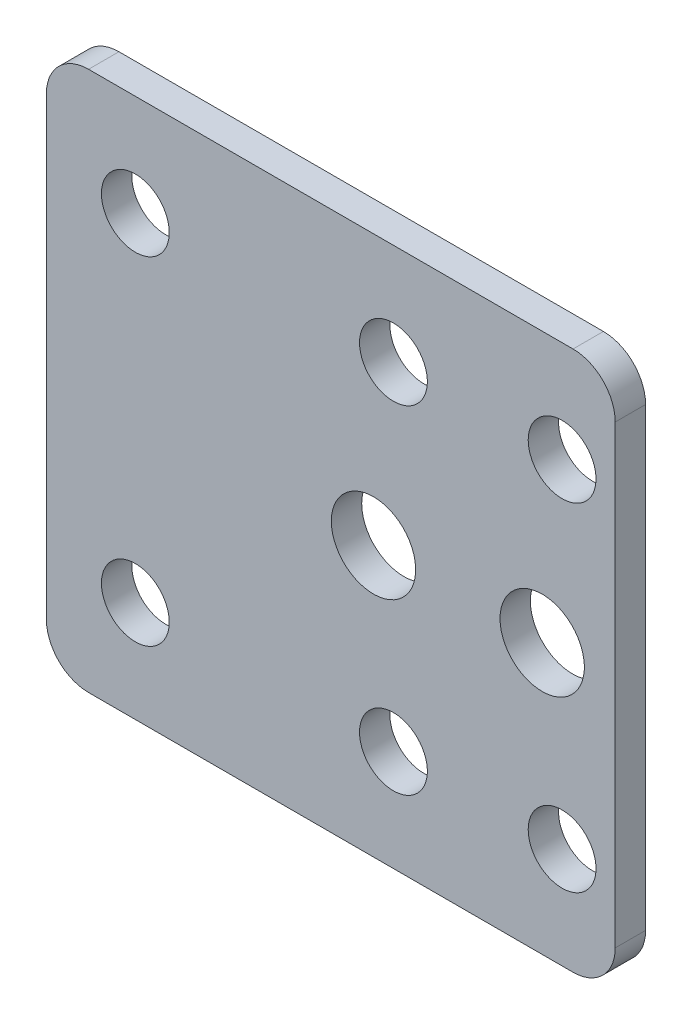
from build123d import *

# Parameters (mm, degrees)
SKETCH1_W              = 76.2
SKETCH1_H              = 40.64
BASE_FLANGE1_DEPTH     = 2.286
CUT_EXTRUDE1_REACH     = 249.845
SKETCH6_R              = 2.5527
SKETCH6_R_2            = 3.175
FILLET1_R              = 3.175
SKETCH7_W              = 53.484881044
SKETCH7_H              = 41.537228889
REMOVE_3RD_STAGE_DEPTH = 2.54
FILLET2_R              = 3.175
SKETCH8_W              = 26.577580406
SKETCH8_H              = 64.780145769
REMOVE_2ND_STAGE_DEPTH = 248.845041068
FILLET3_R              = 3.175


# Sheet-metal steps are written as plain solids
with BuildPart() as part:
    # Sketch1 → Base-Flange1 (new body)
    with BuildSketch(Plane.XY):
        with Locations((-119.218460544, -171.181541922)):
            Rectangle(SKETCH1_W, SKETCH1_H)
    extrude(amount=BASE_FLANGE1_DEPTH)

    # Sketch6 → Cut-Extrude1 (cut, up to next)
    with BuildSketch(Plane(origin=(0, 0, 0), x_dir=(-1, 0, 0), z_dir=(0, 0, -1)), mode=Mode.PRIVATE) as cut_extrude1_sk1:
        with Locations((150.6232, -158.481541922)):
            Circle(SKETCH6_R)
    cut_extrude1_tool1 = extrude(cut_extrude1_sk1.sketch, amount=-CUT_EXTRUDE1_REACH, mode=Mode.PRIVATE) & part.part
    # Sketch6 → Cut-Extrude1 (cut, up to next)
    with BuildSketch(Plane(origin=(0, 0, 0), x_dir=(-1, 0, 0), z_dir=(0, 0, -1)), mode=Mode.PRIVATE) as cut_extrude1_sk2:
        with Locations((150.6232, -183.881541922)):
            Circle(SKETCH6_R)
    cut_extrude1_tool2 = extrude(cut_extrude1_sk2.sketch, amount=-CUT_EXTRUDE1_REACH, mode=Mode.PRIVATE) & part.part
    # Sketch6 → Cut-Extrude1 (cut, up to next)
    with BuildSketch(Plane(origin=(0, 0, 0), x_dir=(-1, 0, 0), z_dir=(0, 0, -1)), mode=Mode.PRIVATE) as cut_extrude1_sk3:
        with Locations((118.4918, -158.481541922)):
            Circle(SKETCH6_R)
    cut_extrude1_tool3 = extrude(cut_extrude1_sk3.sketch, amount=-CUT_EXTRUDE1_REACH, mode=Mode.PRIVATE) & part.part
    # Sketch6 → Cut-Extrude1 (cut, up to next)
    with BuildSketch(Plane(origin=(0, 0, 0), x_dir=(-1, 0, 0), z_dir=(0, 0, -1)), mode=Mode.PRIVATE) as cut_extrude1_sk4:
        with Locations((119.9918, -171.181541922)):
            Circle(SKETCH6_R_2)
    cut_extrude1_tool4 = extrude(cut_extrude1_sk4.sketch, amount=-CUT_EXTRUDE1_REACH, mode=Mode.PRIVATE) & part.part
    # Sketch6 → Cut-Extrude1 (cut, up to next)
    with BuildSketch(Plane(origin=(0, 0, 0), x_dir=(-1, 0, 0), z_dir=(0, 0, -1)), mode=Mode.PRIVATE) as cut_extrude1_sk5:
        with Locations((118.4918, -183.881541922)):
            Circle(SKETCH6_R)
    cut_extrude1_tool5 = extrude(cut_extrude1_sk5.sketch, amount=-CUT_EXTRUDE1_REACH, mode=Mode.PRIVATE) & part.part
    # Sketch6 → Cut-Extrude1 (cut, up to next)
    with BuildSketch(Plane(origin=(0, 0, 0), x_dir=(-1, 0, 0), z_dir=(0, 0, -1)), mode=Mode.PRIVATE) as cut_extrude1_sk6:
        with Locations((131.1918, -158.481541922)):
            Circle(SKETCH6_R)
    cut_extrude1_tool6 = extrude(cut_extrude1_sk6.sketch, amount=-CUT_EXTRUDE1_REACH, mode=Mode.PRIVATE) & part.part
    # Sketch6 → Cut-Extrude1 (cut, up to next)
    with BuildSketch(Plane(origin=(0, 0, 0), x_dir=(-1, 0, 0), z_dir=(0, 0, -1)), mode=Mode.PRIVATE) as cut_extrude1_sk7:
        with Locations((132.6918, -171.181541922)):
            Circle(SKETCH6_R_2)
    cut_extrude1_tool7 = extrude(cut_extrude1_sk7.sketch, amount=-CUT_EXTRUDE1_REACH, mode=Mode.PRIVATE) & part.part
    # Sketch6 → Cut-Extrude1 (cut, up to next)
    with BuildSketch(Plane(origin=(0, 0, 0), x_dir=(-1, 0, 0), z_dir=(0, 0, -1)), mode=Mode.PRIVATE) as cut_extrude1_sk8:
        with Locations((131.1918, -183.881541922)):
            Circle(SKETCH6_R)
    cut_extrude1_tool8 = extrude(cut_extrude1_sk8.sketch, amount=-CUT_EXTRUDE1_REACH, mode=Mode.PRIVATE) & part.part
    # Sketch6 → Cut-Extrude1 (cut, up to next)
    with BuildSketch(Plane(origin=(0, 0, 0), x_dir=(-1, 0, 0), z_dir=(0, 0, -1)), mode=Mode.PRIVATE) as cut_extrude1_sk9:
        with Locations((105.7918, -158.481541922)):
            Circle(SKETCH6_R)
    cut_extrude1_tool9 = extrude(cut_extrude1_sk9.sketch, amount=-CUT_EXTRUDE1_REACH, mode=Mode.PRIVATE) & part.part
    # Sketch6 → Cut-Extrude1 (cut, up to next)
    with BuildSketch(Plane(origin=(0, 0, 0), x_dir=(-1, 0, 0), z_dir=(0, 0, -1)), mode=Mode.PRIVATE) as cut_extrude1_sk10:
        with Locations((107.2918, -171.181541922)):
            Circle(SKETCH6_R_2)
    cut_extrude1_tool10 = extrude(cut_extrude1_sk10.sketch, amount=-CUT_EXTRUDE1_REACH, mode=Mode.PRIVATE) & part.part
    # Sketch6 → Cut-Extrude1 (cut, up to next)
    with BuildSketch(Plane(origin=(0, 0, 0), x_dir=(-1, 0, 0), z_dir=(0, 0, -1)), mode=Mode.PRIVATE) as cut_extrude1_sk11:
        with Locations((105.7918, -183.881541922)):
            Circle(SKETCH6_R)
    cut_extrude1_tool11 = extrude(cut_extrude1_sk11.sketch, amount=-CUT_EXTRUDE1_REACH, mode=Mode.PRIVATE) & part.part
    # Sketch6 → Cut-Extrude1 (cut, up to next)
    with BuildSketch(Plane(origin=(0, 0, 0), x_dir=(-1, 0, 0), z_dir=(0, 0, -1)), mode=Mode.PRIVATE) as cut_extrude1_sk12:
        with Locations((93.0918, -158.481541922)):
            Circle(SKETCH6_R)
    cut_extrude1_tool12 = extrude(cut_extrude1_sk12.sketch, amount=-CUT_EXTRUDE1_REACH, mode=Mode.PRIVATE) & part.part
    # Sketch6 → Cut-Extrude1 (cut, up to next)
    with BuildSketch(Plane(origin=(0, 0, 0), x_dir=(-1, 0, 0), z_dir=(0, 0, -1)), mode=Mode.PRIVATE) as cut_extrude1_sk13:
        with Locations((94.5918, -171.181541922)):
            Circle(SKETCH6_R_2)
    cut_extrude1_tool13 = extrude(cut_extrude1_sk13.sketch, amount=-CUT_EXTRUDE1_REACH, mode=Mode.PRIVATE) & part.part
    # Sketch6 → Cut-Extrude1 (cut, up to next)
    with BuildSketch(Plane(origin=(0, 0, 0), x_dir=(-1, 0, 0), z_dir=(0, 0, -1)), mode=Mode.PRIVATE) as cut_extrude1_sk14:
        with Locations((93.0918, -183.881541922)):
            Circle(SKETCH6_R)
    cut_extrude1_tool14 = extrude(cut_extrude1_sk14.sketch, amount=-CUT_EXTRUDE1_REACH, mode=Mode.PRIVATE) & part.part
    add(cut_extrude1_tool1.solids().sort_by_distance((-150.6232, -158.481542, 0))[0], mode=Mode.SUBTRACT)
    add(cut_extrude1_tool2.solids().sort_by_distance((-150.6232, -183.881542, 0))[0], mode=Mode.SUBTRACT)
    add(cut_extrude1_tool3.solids().sort_by_distance((-118.4918, -158.481542, 0))[0], mode=Mode.SUBTRACT)
    add(cut_extrude1_tool4.solids().sort_by_distance((-119.9918, -171.181542, 0))[0], mode=Mode.SUBTRACT)
    add(cut_extrude1_tool5.solids().sort_by_distance((-118.4918, -183.881542, 0))[0], mode=Mode.SUBTRACT)
    add(cut_extrude1_tool6.solids().sort_by_distance((-131.1918, -158.481542, 0))[0], mode=Mode.SUBTRACT)
    add(cut_extrude1_tool7.solids().sort_by_distance((-132.6918, -171.181542, 0))[0], mode=Mode.SUBTRACT)
    add(cut_extrude1_tool8.solids().sort_by_distance((-131.1918, -183.881542, 0))[0], mode=Mode.SUBTRACT)
    add(cut_extrude1_tool9.solids().sort_by_distance((-105.7918, -158.481542, 0))[0], mode=Mode.SUBTRACT)
    add(cut_extrude1_tool10.solids().sort_by_distance((-107.2918, -171.181542, 0))[0], mode=Mode.SUBTRACT)
    add(cut_extrude1_tool11.solids().sort_by_distance((-105.7918, -183.881542, 0))[0], mode=Mode.SUBTRACT)
    add(cut_extrude1_tool12.solids().sort_by_distance((-93.0918, -158.481542, 0))[0], mode=Mode.SUBTRACT)
    add(cut_extrude1_tool13.solids().sort_by_distance((-94.5918, -171.181542, 0))[0], mode=Mode.SUBTRACT)
    add(cut_extrude1_tool14.solids().sort_by_distance((-93.0918, -183.881542, 0))[0], mode=Mode.SUBTRACT)

    # Fillet1
    fillet1_edges = [part.edges().sort_by_distance(p)[0] for p in [
        (-157.318460544, -150.861541922, 1.143),
        (-81.118460544, -150.861541922, 1.143),
        (-81.118460544, -191.501541922, 1.143),
        (-157.318460544, -191.501541922, 1.143),
    ]]
    fillet(fillet1_edges, radius=FILLET1_R)

    # Sketch7 → Remove 3rd Stage (cut)
    with BuildSketch(Plane.XY.offset(2.286)):
        with Locations((-75.050259478, -170.732927477)):
            Rectangle(SKETCH7_W, SKETCH7_H)
    extrude(amount=-REMOVE_3RD_STAGE_DEPTH, mode=Mode.SUBTRACT)

    # Fillet2
    fillet2_edges = [part.edges().sort_by_distance(p)[0] for p in [
        (-101.7927, -150.861541922, 1.143),
        (-101.7927, -191.501541922, 1.143),
    ]]
    fillet(fillet2_edges, radius=FILLET2_R)

    # Sketch8 → Remove 2nd Stage (cut, through all)
    with BuildSketch(Plane.XY.offset(2.286)):
        with Locations((-101.203909797, -170.174492323)):
            Rectangle(SKETCH8_W, SKETCH8_H)
    extrude(amount=-REMOVE_2ND_STAGE_DEPTH, mode=Mode.SUBTRACT)

    # Fillet3
    fillet3_edges = [part.edges().sort_by_distance(p)[0] for p in [
        (-114.4927, -191.501541922, 1.143),
        (-114.4927, -150.861541922, 1.143),
    ]]
    fillet(fillet3_edges, radius=FILLET3_R)


solid = part.part
